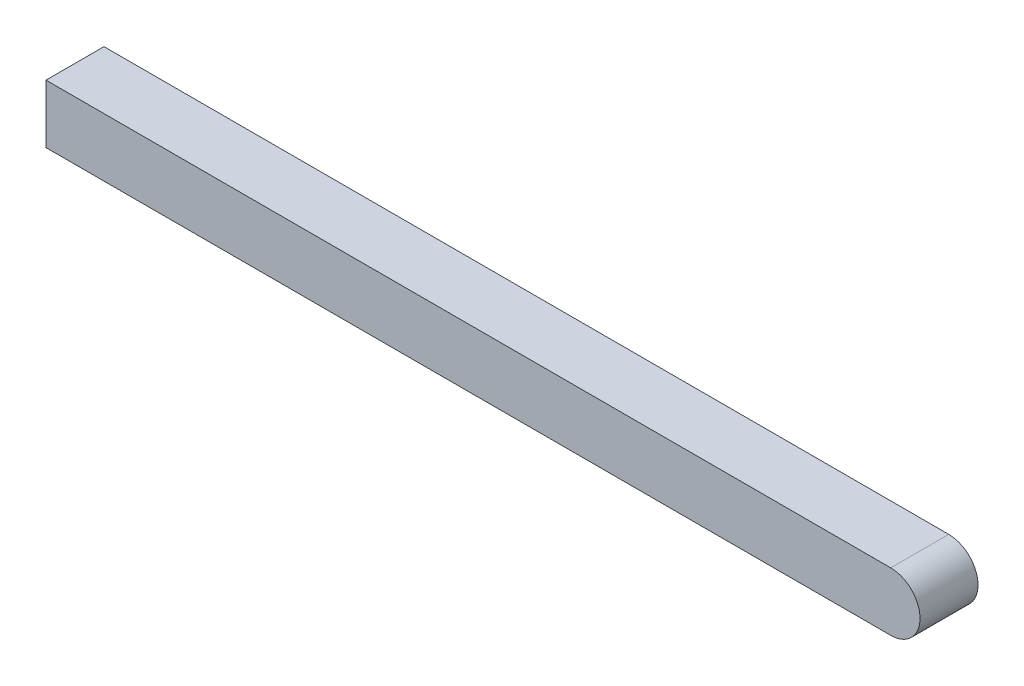
from build123d import *

# Parameters (mm, degrees)
SKETCH_1377_W      = 262.175
SKETCH_1377_H      = 18.15
EXTRUDE_1385_DEPTH = 18
SKETCH_6_R         = 9.075
EXTRUDE_1445_DEPTH = 18


with BuildPart() as part:
    # Sketch 1377 → Extrude 1385 (new body)
    with BuildSketch(Plane.XY):
        with Locations((130.9875, 0)):
            Rectangle(SKETCH_1377_W, SKETCH_1377_H)
    extrude(amount=EXTRUDE_1385_DEPTH)

    # Выход_фрезы6 → Extrude 1445 (add)
    with BuildSketch(Plane.XY):
        with Locations((262.075, 0)):
            Circle(SKETCH_6_R)
    extrude(amount=EXTRUDE_1445_DEPTH)


solid = part.part
